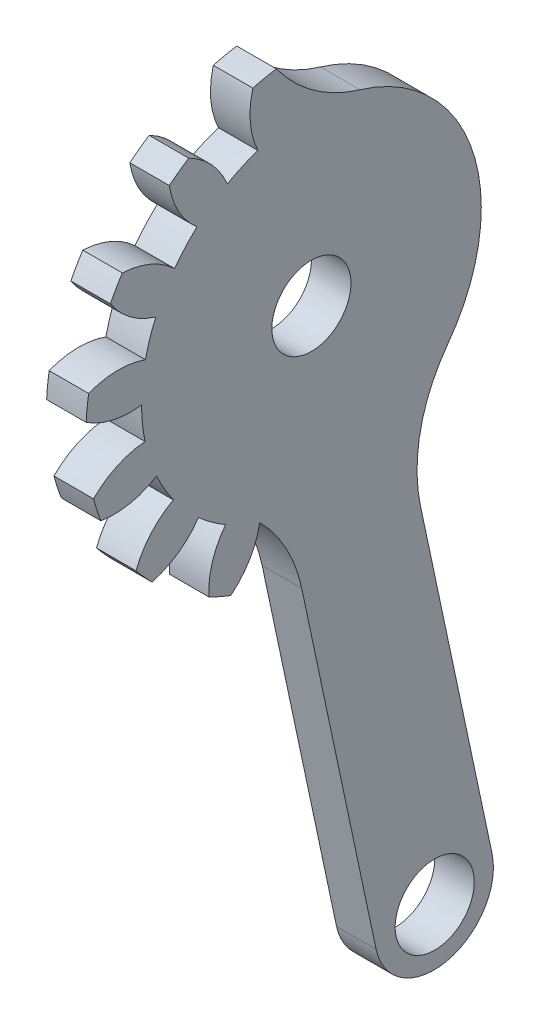
from build123d import *

# Parameters (mm, degrees)
SKETCH1_R           = 1.5
BOSS_EXTRUDE1_DEPTH = 2
SKETCH3_OUTSIDE_W   = 31.914
SKETCH3_OUTSIDE_H   = 31.796
SKETCH3_OUTSIDE_R   = 11.40725
CUT_EXTRUDE1_DEPTH  = 17.630863493
SKETCH4_R           = 2
CUT_EXTRUDE2_DEPTH  = 17.245136509
BOSS_EXTRUDE3_DEPTH = 2
CUT_EXTRUDE3_DEPTH  = 35.211805454
FILLET1_R           = 8


with BuildPart() as part:
    # Sketch1 → Boss-Extrude1 (new body)
    with BuildSketch(Plane(origin=(-1.354941904, 0, 0), x_dir=(0, 0, -1), z_dir=(1, 0, 0))):
        with BuildLine():
            ThreePointArc((-11.66138775, 0.780827758), (-10.210393031, 0.057188521), (-8.592596732, -0.051322118))
            ThreePointArc((-8.592596732, -0.051322118), (-8.545678016, -0.898186953), (-8.415498346, -1.736300708))
            ThreePointArc((-8.415498346, -1.736300708), (-9.975381284, -2.178798893), (-11.24421523, -3.188303642))
            ThreePointArc((-11.24421523, -3.188303642), (-11.115473034, -3.611636122), (-10.97079907, -4.029792056))
            ThreePointArc((-10.97079907, -4.029792056), (-9.350918841, -4.100696673), (-7.828853128, -3.541809038))
            ThreePointArc((-7.828853128, -3.541809038), (-7.441539788, -4.296375), (-6.981723166, -5.009081172))
            ThreePointArc((-6.981723166, -5.009081172), (-8.226766912, -6.047784929), (-8.975301827, -7.486094667))
            ThreePointArc((-8.975301827, -7.486094667), (-8.685505148, -7.820463962), (-8.383259564, -8.143624213))
            ThreePointArc((-8.383259564, -8.143624213), (-6.874585833, -7.549534157), (-5.711429695, -6.419884999))
            ThreePointArc((-5.711429695, -6.419884999), (-5.050691727, -6.951680778), (-4.340744624, -7.415745996))
            ThreePointArc((-4.340744624, -7.415745996), (-5.055669804, -8.871054007), (-5.154477201, -10.489471914))
            ThreePointArc((-5.154477201, -10.489471914), (-4.753734516, -10.677062536), (-4.34617832, -10.849349762))
            ThreePointArc((-4.34617832, -10.849349762), (-3.209574481, -9.692988601), (-2.606448181, -8.187904521))
            ThreePointArc((-2.606448181, -8.187904521), (-1.786533181, -8.404977796), (-0.949211902, -8.540160966))
            ThreePointArc((-0.949211902, -8.540160966), (-1.010401457, -10.160437258), (-0.442396639, -11.679124174))
            ThreePointArc((-0.442396639, -11.679124174), (0, -11.6875), (0.442396639, -11.679124174))
            ThreePointArc((0.442396639, -11.679124174), (1.010401457, -10.160437258), (0.949211902, -8.540160966))
            ThreePointArc((0.949211902, -8.540160966), (1.786533181, -8.404977796), (2.606448181, -8.187904521))
            ThreePointArc((2.606448181, -8.187904521), (3.209574481, -9.692988601), (4.34617832, -10.849349762))
            ThreePointArc((4.34617832, -10.849349762), (4.753734516, -10.677062536), (5.154477201, -10.489471914))
            ThreePointArc((5.154477201, -10.489471914), (5.055669804, -8.871054007), (4.340744624, -7.415745996))
            ThreePointArc((4.340744624, -7.415745996), (5.050691727, -6.951680778), (5.711429695, -6.419884999))
            ThreePointArc((5.711429695, -6.419884999), (6.874585833, -7.549534157), (8.383259564, -8.143624213))
            ThreePointArc((8.383259564, -8.143624213), (8.685505148, -7.820463962), (8.975301827, -7.486094667))
            ThreePointArc((8.975301827, -7.486094667), (8.226766912, -6.047784929), (6.981723166, -5.009081172))
            ThreePointArc((6.981723166, -5.009081172), (7.441539788, -4.296375), (7.828853128, -3.541809038))
            ThreePointArc((7.828853128, -3.541809038), (9.350918841, -4.100696673), (10.97079907, -4.029792056))
            ThreePointArc((10.97079907, -4.029792056), (11.115473034, -3.611636122), (11.24421523, -3.188303642))
            ThreePointArc((11.24421523, -3.188303642), (9.975381284, -2.178798893), (8.415498346, -1.736300708))
            ThreePointArc((8.415498346, -1.736300708), (8.545678016, -0.898186953), (8.592596732, -0.051322118))
            ThreePointArc((8.592596732, -0.051322118), (10.210393031, 0.057188521), (11.66138775, 0.780827758))
            ThreePointArc((11.66138775, 0.780827758), (11.623474652, 1.221676414), (11.568901669, 1.660774047))
            ThreePointArc((11.568901669, 1.660774047), (9.999161608, 2.066921265), (8.394157409, 1.836701922))
            ThreePointArc((8.394157409, 1.836701922), (8.17219088, 2.655305778), (7.8706023, 3.448038862))
            ThreePointArc((7.8706023, 3.448038862), (9.304397507, 4.205185299), (10.335616548, 5.456435359))
            ThreePointArc((10.335616548, 5.456435359), (10.121671907, 5.84375), (9.893219909, 6.222688815))
            ThreePointArc((9.893219909, 6.222688815), (8.29399605, 5.955251959), (6.921390398, 5.092122104))
            ThreePointArc((6.921390398, 5.092122104), (6.385657699, 5.749672018), (5.787709228, 6.351202599))
            ThreePointArc((5.787709228, 6.351202599), (6.789587127, 7.626067336), (7.222723349, 9.188575716))
            ThreePointArc((7.222723349, 9.188575716), (6.869740136, 9.455386122), (6.506910549, 9.708644156))
            ThreePointArc((6.506910549, 9.708644156), (5.154723227, 8.813865487), (4.251852108, 7.467068114))
            ThreePointArc((4.251852108, 7.467068114), (3.49498629, 7.849867731), (2.704068651, 8.156185707))
            ThreePointArc((2.704068651, 8.156185707), (3.100795451, 9.728333051), (2.860955666, 11.331927856))
            ThreePointArc((2.860955666, 11.331927856), (2.429967886, 11.432100084), (1.995497243, 11.515886722))
            ThreePointArc((1.995497243, 11.515886722), (1.124151929, 10.148481601), (0.847129962, 8.55089021))
            ThreePointArc((0.847129962, 8.55089021), (0, 8.59275), (-0.847129962, 8.55089021))
            ThreePointArc((-0.847129962, 8.55089021), (-1.124151929, 10.148481601), (-1.995497243, 11.515886722))
            ThreePointArc((-1.995497243, 11.515886722), (-2.429967886, 11.432100084), (-2.860955666, 11.331927856))
            ThreePointArc((-2.860955666, 11.331927856), (-3.100795451, 9.728333051), (-2.704068651, 8.156185707))
            ThreePointArc((-2.704068651, 8.156185707), (-3.49498629, 7.849867731), (-4.251852108, 7.467068114))
            ThreePointArc((-4.251852108, 7.467068114), (-5.154723227, 8.813865487), (-6.506910549, 9.708644156))
            ThreePointArc((-6.506910549, 9.708644156), (-6.869740136, 9.455386122), (-7.222723349, 9.188575716))
            ThreePointArc((-7.222723349, 9.188575716), (-6.789587127, 7.626067336), (-5.787709228, 6.351202599))
            ThreePointArc((-5.787709228, 6.351202599), (-6.385657699, 5.749672018), (-6.921390398, 5.092122104))
            ThreePointArc((-6.921390398, 5.092122104), (-8.29399605, 5.955251959), (-9.893219909, 6.222688815))
            ThreePointArc((-9.893219909, 6.222688815), (-10.121671907, 5.84375), (-10.335616548, 5.456435359))
            ThreePointArc((-10.335616548, 5.456435359), (-9.304397507, 4.205185299), (-7.8706023, 3.448038862))
            ThreePointArc((-7.8706023, 3.448038862), (-8.17219088, 2.655305778), (-8.394157409, 1.836701922))
            ThreePointArc((-8.394157409, 1.836701922), (-9.999161608, 2.066921265), (-11.568901669, 1.660774047))
            ThreePointArc((-11.568901669, 1.660774047), (-11.623474652, 1.221676414), (-11.66138775, 0.780827758))
        make_face()
        with Locations(Location((0, 0, 0), (0, 0, 180))):
            Circle(SKETCH1_R, mode=Mode.SUBTRACT)
    extrude(amount=-BOSS_EXTRUDE1_DEPTH)

    # Sketch3 outside → Cut-Extrude1 (cut, through all)
    with BuildSketch(Plane(origin=(-1.354941904, 0, 0), x_dir=(0, 0, -1), z_dir=(1, 0, 0))):
        with Locations((0, -0.086)):
            Rectangle(SKETCH3_OUTSIDE_W, SKETCH3_OUTSIDE_H)
        Circle(SKETCH3_OUTSIDE_R, mode=Mode.SUBTRACT)
    extrude(amount=-CUT_EXTRUDE1_DEPTH, mode=Mode.SUBTRACT)

    # Sketch4 → Cut-Extrude2 (cut, through all)
    with BuildSketch(Plane.ZY.offset(3.354941904)):
        Circle(SKETCH4_R)
    extrude(amount=-CUT_EXTRUDE2_DEPTH, mode=Mode.SUBTRACT)

    # Sketch5 → Boss-Extrude3 (add)
    with BuildSketch(Plane(origin=(-1.354941904, 0, 0), x_dir=(0, 0, -1), z_dir=(1, 0, 0))):
        with BuildLine():
            Line((5.821527343, -27.388132821), (0.895701941, -4.213946322))
            Line((0.895701941, -4.213946322), (-2.171319843, -4.213946322))
            Line((-2.171319843, -4.213946322), (3.27164281, -29.821072303))
            ThreePointArc((3.27164281, -29.821072303), (4.572168507, -31.713348935), (6.829820684, -32.131780033))
            Line((6.829820684, -32.131780033), (6.653174106, -31.300723223))
            ThreePointArc((6.653174106, -31.300723223), (4.281055523, -29.760251404), (5.821527343, -27.388132821))
        make_face()
        with BuildLine():
            Line((3.962723726, -4.213946322), (0.895701941, -4.213946322))
            Line((0.895701941, -4.213946322), (5.821527343, -27.388132821))
            ThreePointArc((5.821527343, -27.388132821), (7.495991507, -27.790136099), (8.237350725, -29.344428022))
            ThreePointArc((8.237350725, -29.344428022), (7.791642647, -30.603068804), (6.653174106, -31.300723223))
            Line((6.653174106, -31.300723223), (6.829820684, -32.131780033))
            ThreePointArc((6.829820684, -32.131780033), (8.722097316, -30.831254336), (9.140528414, -28.573602159))
            Line((9.140528414, -28.573602159), (3.962723726, -4.213946322))
        make_face()
    extrude(amount=-BOSS_EXTRUDE3_DEPTH)

    # Sketch6 → Cut-Extrude3 (cut, through all)
    with BuildSketch(Plane(origin=(-1.354941904, 0, 0), x_dir=(0, 0, -1), z_dir=(1, 0, 0))):
        with BuildLine():
            ThreePointArc((4.60855611, -7.252348802), (8.250847615, 2.39976378), (0, 8.59275))
            Line((0, 8.59275), (0, 11.449359201))
            ThreePointArc((0, 11.449359201), (11.128561829, 2.691270657), (5.231728933, -10.184146429))
            Line((5.231728933, -10.184146429), (4.60855611, -7.252348802))
        make_face()
        with BuildLine():
            ThreePointArc((-1.878840334, -8.384826269), (-1.570637651, -8.447984963), (-1.260329494, -8.499818947))
            Line((-1.260329494, -8.499818947), (-0.637156671, -11.431616574))
            ThreePointArc((-0.637156671, -11.431616574), (-1.575646482, -11.340421698), (-2.503449753, -11.172312449))
            Line((-2.503449753, -11.172312449), (-1.878840334, -8.384826269))
        make_face()
    extrude(amount=-CUT_EXTRUDE3_DEPTH, mode=Mode.SUBTRACT)

    # Fillet1
    # the kernel refuses this fillet: 8 mm, written as the material it adds along each edge
    with BuildSketch(Plane(origin=(-3.354941904, -8.499818947, 1.260329494), x_dir=(0, -0.978147600733804, -0.20791169081776692), z_dir=(1, 0, 0))) as fillet1_piece_1:
        with BuildLine():
            CenterArc((3.711828979, -8), FILLET1_R, 90, 32.486450305)
            Line((-0.58497216, -1.251852108), (-0.670908182, -1.11688915))
            ThreePointArc((-0.670908182, -1.11688915), (-0.412236702, -0.569968342), (-0.149931796, 0.055861046))
            Line((-0.149931796, 0.055861046), (0, 0.16))
            Line((0, 0.16), (3.711828979, 0.16))
            Line((3.711828979, 0.16), (3.711828979, 0))
        make_face()
    extrude(amount=2)
    with BuildSketch(Plane(origin=(-3.354941904, -7.252348802, -4.60855611), x_dir=(0, 0.6817347093363165, -0.7315994710810882), z_dir=(1, 0, 0))) as fillet1_piece_2:
        with BuildLine():
            CenterArc((4.609202788, -7.864888151), FILLET1_R, 100.545143381, 48.475508098)
            Line((-2.24962028, -3.747055453), (-2.386796741, -3.664698799))
            Line((-2.386796741, -3.664698799), (-0.137176461, 0.082356654))
            Line((-0.137176461, 0.082356654), (0.029281628, 0.157297763))
            ThreePointArc((0.029281628, 0.157297763), (1.57256069, 0.014877208), (3.115839752, 0.157297763))
            Line((3.115839752, 0.157297763), (3.14512138, 0))
        make_face()
    extrude(amount=2)
    with BuildSketch(Plane(origin=(-1.354941904, 8.55089021, 0.847129962), x_dir=(0, 0.9533192219499187, 0.3019643373989743), z_dir=(-1, 0, 0))) as fillet1_piece_3:
        with BuildLine():
            CenterArc((5.310026661, 7.560828727), FILLET1_R, 214.236741242, 36.690361487)
            Line((-1.30373306, 3.059919669), (-1.436008254, 2.969901488))
            ThreePointArc((-1.436008254, 2.969901488), (-0.64959553, 1.530927434), (-0.156551158, -0.03304141))
            Line((-0.156551158, -0.03304141), (0.052283339, -0.151216575))
            ThreePointArc((0.052283339, -0.151216575), (1.347929845, 0.066447687), (2.64357635, -0.151216575))
            Line((2.64357635, -0.151216575), (2.69585969, 0))
        make_face()
    extrude(amount=2)


solid = part.part
